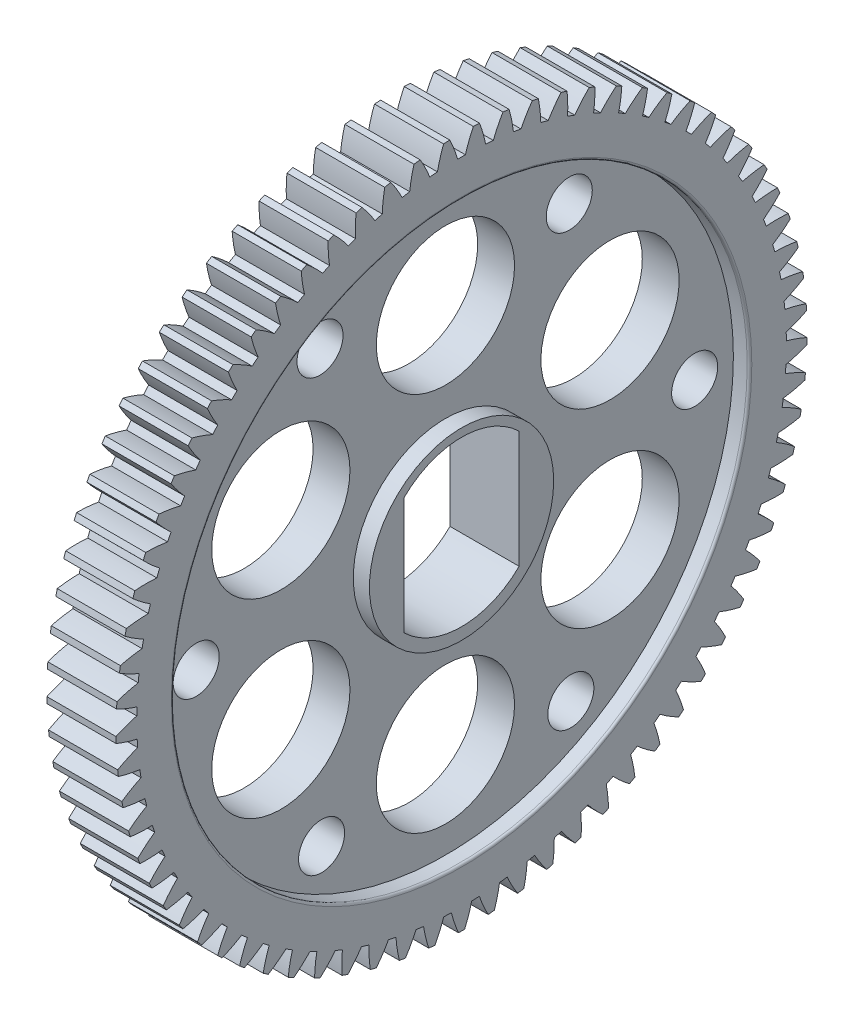
from build123d import *

# Parameters (mm, degrees)
BASPROSKE_W         = 15
BASPROSKE_H         = 75
TOOTHCUT_DEPTH      = 108.121426428
TEETHCUTS_COUNT     = 73
TEETHCUTS_ANGLE     = 355.068493151
BORSKE_R            = 0.4
BORE_DEPTH          = 50.0000508
SKETCH1_R           = 62.5
CUT_EXTRUDE1_DEPTH  = 3.5
CUT_EXTRUDE2_START  = -11.5
SKETCH1_2_R         = 62.5
CUT_EXTRUDE2_DEPTH  = 3.5
FILLET1_R           = 0.5
SKETCH2_R           = 20
BOSS_EXTRUDE1_DEPTH = 3.5
BOSS_EXTRUDE2_START = -11.5
SKETCH2_2_R         = 20
BOSS_EXTRUDE2_DEPTH = 3.5
CUT_EXTRUDE3_REACH  = 109.117
CUT_EXTRUDE4_REACH  = 108.683
SKETCH4_R           = 15
SKETCH4_R_2         = 5
CIRPATTERN1_COUNT   = 6


with BuildPart() as part:
    # BasProSke → Base-Revolve (revolve)
    with BuildSketch(Plane(origin=(0, 0, 0), x_dir=(1, 0, 0), z_dir=(0, 1, 0)), mode=Mode.PRIVATE) as base_revolve_sk:
        with Locations((7.5, 37.5)):
            Rectangle(BASPROSKE_W, BASPROSKE_H)
    revolve(base_revolve_sk.sketch.rotate(Axis((-10, 0, 0), (1, 0, 0)), 180), axis=Axis((-10, 0, 0), (1, 0, 0)))

    # TooCutSke → ToothCut (cut, through all)
    with BuildSketch(Plane(origin=(0, 0, 0), x_dir=(0, 0, -1), z_dir=(1, 0, 0))):
        with BuildLine():
            ThreePointArc((0.831762675, 70.49409317), (0, 70.499), (-0.831762675, 70.49409317))
            ThreePointArc((-0.831762675, 70.49409317), (-1.606990857, 72.773584485), (-2.567381061, 74.981459039))
            ThreePointArc((-2.567381061, 74.981459039), (0, 75.0254), (2.567381061, 74.981459039))
            ThreePointArc((2.567381061, 74.981459039), (1.606990857, 72.773584485), (0.831762675, 70.49409317))
        make_face()
    toothcut = extrude(amount=TOOTHCUT_DEPTH, mode=Mode.SUBTRACT)

    # TeethCuts: ToothCut ×73 about axis
    teethcuts_axis = Axis((-10, 0, 0), (1, 0, 0))
    for i in range(1, TEETHCUTS_COUNT):
        add(toothcut.rotate(teethcuts_axis, i * TEETHCUTS_ANGLE / (TEETHCUTS_COUNT - 1)), mode=Mode.SUBTRACT)

    # BorSke → Bore (cut, symmetric)
    with BuildSketch(Plane(origin=(0, 0, 0), x_dir=(0, 0, -1), z_dir=(1, 0, 0))):
        with Locations(Location((0, 0, 0), (0, 0, 180))):
            Circle(BORSKE_R)
    extrude(amount=BORE_DEPTH, both=True, mode=Mode.SUBTRACT)

    # Sketch1 → Cut-Extrude1 (cut)
    with BuildSketch(Plane(origin=(15, 0, 0), x_dir=(0, 0, -1), z_dir=(1, 0, 0))):
        Circle(SKETCH1_R)
    extrude(amount=-CUT_EXTRUDE1_DEPTH, mode=Mode.SUBTRACT)

    # Sketch1<2> → Cut-Extrude2 (cut)
    with BuildSketch(Plane(origin=(15, 0, 0), x_dir=(0, 0, -1), z_dir=(1, 0, 0)).offset(CUT_EXTRUDE2_START)):
        Circle(SKETCH1_2_R)
    extrude(amount=-CUT_EXTRUDE2_DEPTH, mode=Mode.SUBTRACT)

    # Fillet1
    fillet1_edges = [part.edges().sort_by_distance(p)[0] for p in [
        (15, 0, 62.5),
        (0, 0, 62.5),
    ]]
    fillet(fillet1_edges, radius=FILLET1_R)

    # Sketch2 → Boss-Extrude1 (add)
    with BuildSketch(Plane.ZY.offset(-3.5)):
        with Locations(Location((0, -0.4, 0), (0, 0, 180))):
            Circle(SKETCH2_R)
    extrude(amount=BOSS_EXTRUDE1_DEPTH)

    # Sketch2<2> → Boss-Extrude2 (add)
    with BuildSketch(Plane.ZY.offset(-3.5).offset(BOSS_EXTRUDE2_START)):
        with Locations(Location((0, -0.4, 0), (0, 0, 180))):
            Circle(SKETCH2_2_R)
    extrude(amount=BOSS_EXTRUDE2_DEPTH)

    # Sketch3 → Cut-Extrude3 (cut, up to next)
    with BuildSketch(Plane(origin=(15, 0, 0), x_dir=(0, 0, -1), z_dir=(1, 0, 0)), mode=Mode.PRIVATE) as cut_extrude3_sk1:
        with BuildLine():
            Line((12.5, 12.697260353), (12.5, -12.697260353))
            ThreePointArc((12.5, -12.697260353), (0, -17.81769964), (-12.5, -12.697260353))
            Line((-12.5, -12.697260353), (-12.5, 12.697260353))
            ThreePointArc((-12.5, 12.697260353), (0, 17.81769964), (12.5, 12.697260353))
        make_face()
    cut_extrude3_tool1 = extrude(cut_extrude3_sk1.sketch, amount=-CUT_EXTRUDE3_REACH, mode=Mode.PRIVATE) & part.part
    add(cut_extrude3_tool1.solids().sort_by_distance((15, 0, 0))[0], mode=Mode.SUBTRACT)

    # Sketch4 → Cut-Extrude4 (cut, up to next)
    with BuildSketch(Plane(origin=(11.5, 0, 0), x_dir=(0, 0, -1), z_dir=(1, 0, 0)), mode=Mode.PRIVATE) as cut_extrude4_sk1:
        with Locations((0, 40.85)):
            Circle(SKETCH4_R)
    cut_extrude4_tool1 = extrude(cut_extrude4_sk1.sketch, amount=-CUT_EXTRUDE4_REACH, mode=Mode.PRIVATE) & part.part
    # Sketch4 → Cut-Extrude4 (cut, up to next)
    with BuildSketch(Plane(origin=(11.5, 0, 0), x_dir=(0, 0, -1), z_dir=(1, 0, 0)), mode=Mode.PRIVATE) as cut_extrude4_sk2:
        with Locations((26.872657708, 46.544808485)):
            Circle(SKETCH4_R_2)
    cut_extrude4_tool2 = extrude(cut_extrude4_sk2.sketch, amount=-CUT_EXTRUDE4_REACH, mode=Mode.PRIVATE) & part.part
    cut_extrude4_1 = cut_extrude4_tool1.solids().sort_by_distance((11.5, 40.85, 0))[0]
    add(cut_extrude4_1, mode=Mode.SUBTRACT)
    cut_extrude4_2 = cut_extrude4_tool2.solids().sort_by_distance((11.5, 46.544808, -26.872658))[0]
    add(cut_extrude4_2, mode=Mode.SUBTRACT)
    cut_extrude4 = cut_extrude4_1 + cut_extrude4_2  # Cut-Extrude4 as one shape, for the pattern or mirror that repeats it

    # CirPattern1: Cut-Extrude4 ×6 about axis
    cirpattern1_axis = Axis((0, -0.4, 0), (1, 0, 0))
    for i in range(1, CIRPATTERN1_COUNT):
        add(cut_extrude4.rotate(cirpattern1_axis, i * 360 / CIRPATTERN1_COUNT), mode=Mode.SUBTRACT)


solid = part.part
